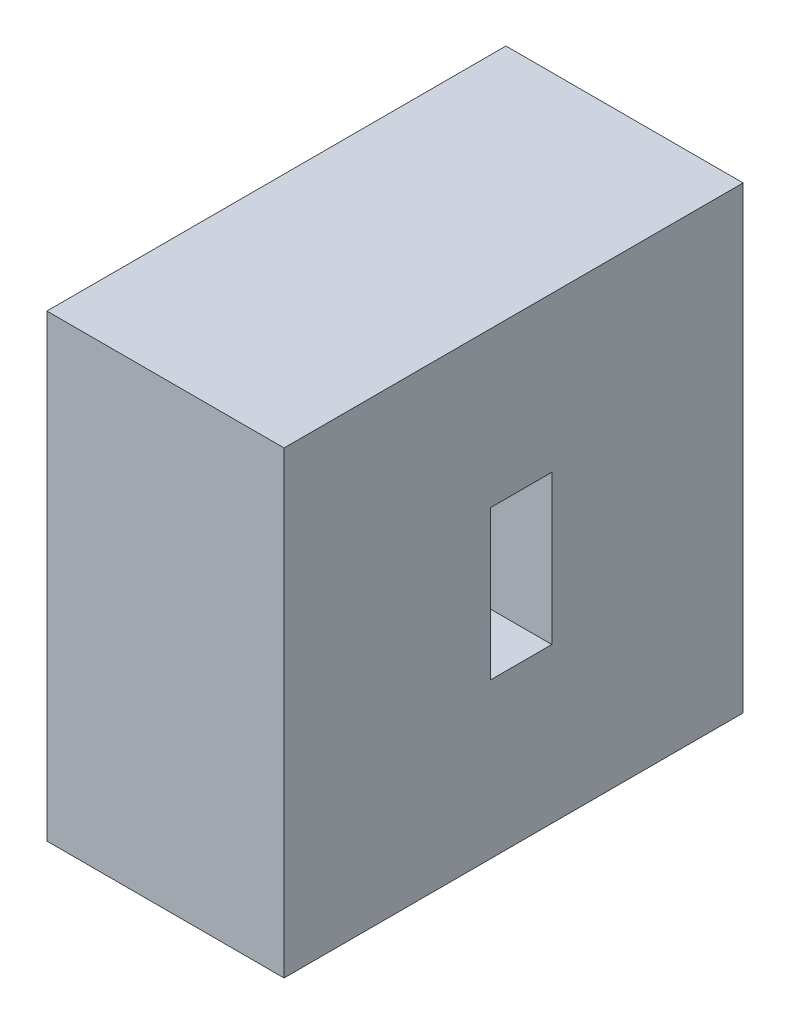
from build123d import *

# Parameters (mm, degrees)
BOSS_EXTRUDE1_START = 144
SKETCH1_W           = 6.2
SKETCH1_H           = 12
BOSS_EXTRUDE1_DEPTH = 12
BOSS_EXTRUDE2_START = 149
SKETCH2_W           = 2.8
SKETCH2_H           = 3.9
BOSS_EXTRUDE2_DEPTH = 1.6
BOSS_EXTRUDE3_START = 149
SKETCH3_W           = 1.7
SKETCH3_H           = 3.9
BOSS_EXTRUDE3_DEPTH = 2.1


with BuildPart() as part:
    # Sketch1 → Boss-Extrude1 (new body)
    with BuildSketch(Plane.XY.offset(BOSS_EXTRUDE1_START)):
        with Locations((52.5, 0)):
            Rectangle(SKETCH1_W, SKETCH1_H)
    extrude(amount=BOSS_EXTRUDE1_DEPTH)


with BuildPart() as body_2:
    # Sketch2 → Boss-Extrude2 (new body)
    with BuildSketch(Plane.XY.offset(BOSS_EXTRUDE2_START)):
        with Locations((54.3, 0)):
            Rectangle(SKETCH2_W, SKETCH2_H)
    extrude(amount=BOSS_EXTRUDE2_DEPTH)


with BuildPart() as part_1:
    add(part.part)

    # Combine1: cut body 2
    add(body_2.part, mode=Mode.SUBTRACT)


with BuildPart() as body_2_2:
    # Sketch3 → Boss-Extrude3 (new body)
    with BuildSketch(Plane.XY.offset(BOSS_EXTRUDE3_START)):
        with Locations((52.05, 0)):
            Rectangle(SKETCH3_W, SKETCH3_H)
    extrude(amount=BOSS_EXTRUDE3_DEPTH)


with BuildPart() as part_2:
    add(part_1.part)

    # Combine2: cut body 2 2
    add(body_2_2.part, mode=Mode.SUBTRACT)


solid = part_2.part
